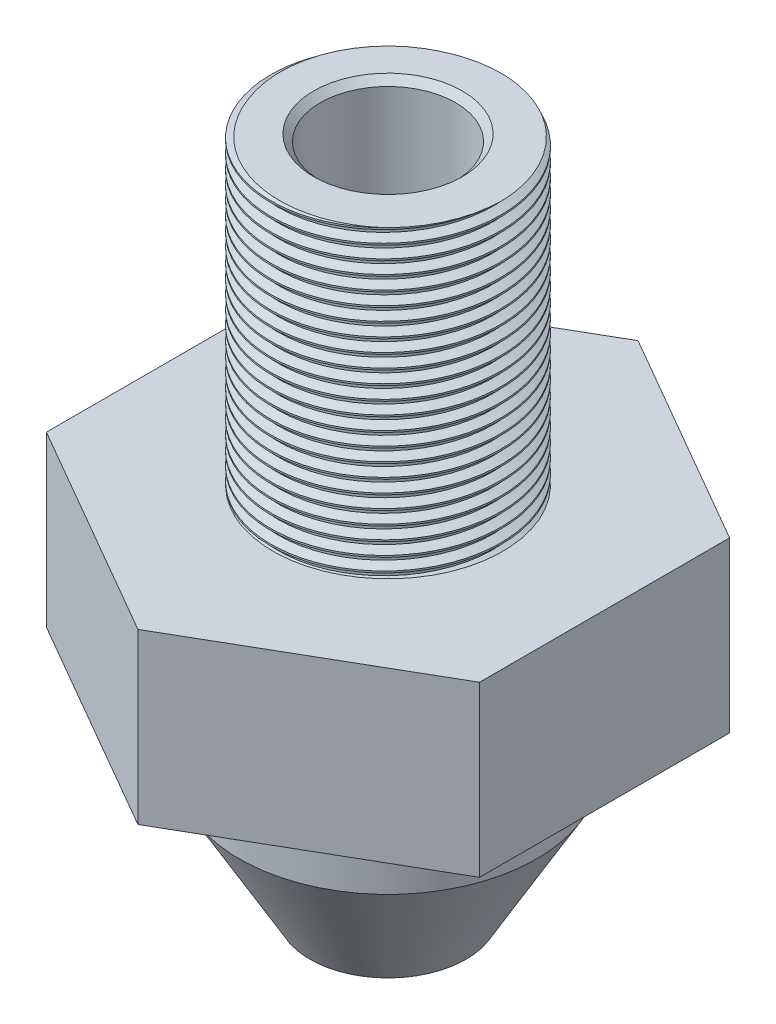
from build123d import *
from OCP.BRepFilletAPI import BRepFilletAPI_MakeChamfer

# Parameters (mm, degrees)
THREAD1_PITCH      = 5.08
CHAMFER1_SIZE      = 12.7
SKETCH20_OUTSIDE_W = 263.492
SKETCH20_OUTSIDE_H = 263.492
CUT_EXTRUDE1_DEPTH = 222.984956412
CHAMFER2_SIZE      = 2.54
CHAMFER2_SIZE2     = 1.859409051


with BuildPart() as part:
    # Sketch1 → Revolve1 (revolve)
    with BuildSketch(Plane.XY, mode=Mode.PRIVATE) as revolve1_sk:
        Polygon((-25.4, 254), (-25.4, 25.4), (-10.735303163, 0), (-29.351637459, 0), (-55.88, 45.948471763), (-55.88, 76.2), (-93.98, 76.2), (-93.98, 139.7), (-43.18, 139.7), (-43.18, 254), align=None)
    revolve(revolve1_sk.sketch.rotate(Axis((0, 0, 0), (0, 1, 0)), 270), axis=Axis((0, 0, 0), (0, 1, 0)))

    # Thread1: arcs per turn and ends read off the stored shape
    # Thread1: the profile of Thread Profile1 profile screwed along a right-hand helix through 25 turns, 12 arcs to a turn; built about Z, then put on its axis
    thread1_z = Axis((0, 0, 0), (0, 0, 1))
    thread1_corners = [(43.1803, 0, -0.000173205), (43.1803, 0, 4.445173191), (40.430369355, 0, 2.857499993), (40.430369355, 0, 1.587499993)]
    with BuildLine(mode=Mode.PRIVATE) as thread1_profile:
        Line(thread1_corners[0], thread1_corners[1])
        Line(thread1_corners[1], thread1_corners[2])
        Line(thread1_corners[2], thread1_corners[3])
        Line(thread1_corners[3], thread1_corners[0])
    thread1_cap = Face(thread1_profile.wire())
    thread1_turn_angles = [0, 15, 30, 45, 60, 75, 90, 105, 120, 135, 150, 165, 180, 195, 210, 225, 240, 255, 270, 285, 300, 315, 330, 345, 360]
    thread1_turn_weights = [1, 0.9659258262890683, 1, 0.9659258262890683, 1, 0.9659258262890683, 1, 0.9659258262890683, 1, 0.9659258262890683, 1, 0.9659258262890683, 1, 0.9659258262890683, 1, 0.9659258262890683, 1, 0.9659258262890683, 1, 0.9659258262890683, 1, 0.9659258262890683, 1, 0.9659258262890683, 1]
    thread1_turn_rails = [Edge.make_bspline([Vector(p[0], p[1], 0).rotate(thread1_z, thread1_turn_angles[k]) / thread1_turn_weights[k] + Vector(0, 0, p[2] + THREAD1_PITCH * thread1_turn_angles[k] / 360) for k in range(25)], [0, 0, 0, 1, 1, 2, 2, 3, 3, 4, 4, 5, 5, 6, 6, 7, 7, 8, 8, 9, 9, 10, 10, 11, 11, 12, 12, 12], 2, thread1_turn_weights) for p in thread1_corners]
    thread1_turn_sides = [Face.make_surface_from_curves(thread1_turn_rails[p[0]], thread1_turn_rails[p[1]]) for p in [(0, 1), (1, 2), (2, 3), (3, 0)]]
    thread1 = Plane(origin=(0, 266.7, 0), x_dir=(-1, 0, 0), z_dir=(0, -1, 0)) * Solid(Shell([*[p.moved(Location((0, 0, THREAD1_PITCH * i))) for i in range(25) for p in thread1_turn_sides], thread1_cap, thread1_cap.rotate(thread1_z, 9000).moved(Location((0, 0, THREAD1_PITCH * 9000 / 360)))]))
    add(thread1, mode=Mode.SUBTRACT)

    # Chamfer1
    chamfer1_edges = [part.edges().sort_by_distance(p)[0] for p in [
        (0, 76.2, 55.88),
    ]]
    chamfer(chamfer1_edges, length=CHAMFER1_SIZE)

    # Sketch20 outside → Cut-Extrude1 (cut, through all)
    with BuildSketch(Plane.XZ.offset(-76.2)):
        Rectangle(SKETCH20_OUTSIDE_W, SKETCH20_OUTSIDE_H)
        Polygon((0, 93.98), (-81.389067448, 46.99), (-81.389067448, -46.99), (0, -93.98), (81.389067448, -46.99), (81.389067448, 46.99), align=None, mode=Mode.SUBTRACT)
    extrude(amount=-CUT_EXTRUDE1_DEPTH, mode=Mode.SUBTRACT)

    # Chamfer2: one chamfer whose edges measure the first distance from different faces: ONE call of the kernel's chamfer builder (chamfer() names one face for all edges)
    chamfer2_edges_1 = [part.edges().sort_by_distance(p)[0] for p in [
        (0, 0, 10.735303163),
    ]]
    chamfer2_side_1 = [part.faces().sort_by_distance(p)[0] for p in [
        (0, 0, 11.565492838),
    ]]
    chamfer2_edges_2 = [part.edges().sort_by_distance(p)[0] for p in [
        (0, 254, 25.4),
    ]]
    chamfer2 = BRepFilletAPI_MakeChamfer(part.part.solid().wrapped)
    for e in chamfer2_edges_1:
        chamfer2.Add(CHAMFER2_SIZE, CHAMFER2_SIZE2, e.wrapped, chamfer2_side_1[0].wrapped)  # the first distance lies on this face
    for e in chamfer2_edges_2:
        chamfer2.Add(CHAMFER2_SIZE, e.wrapped)
    add(Compound.cast(chamfer2.Shape()), mode=Mode.REPLACE)


solid = part.part
